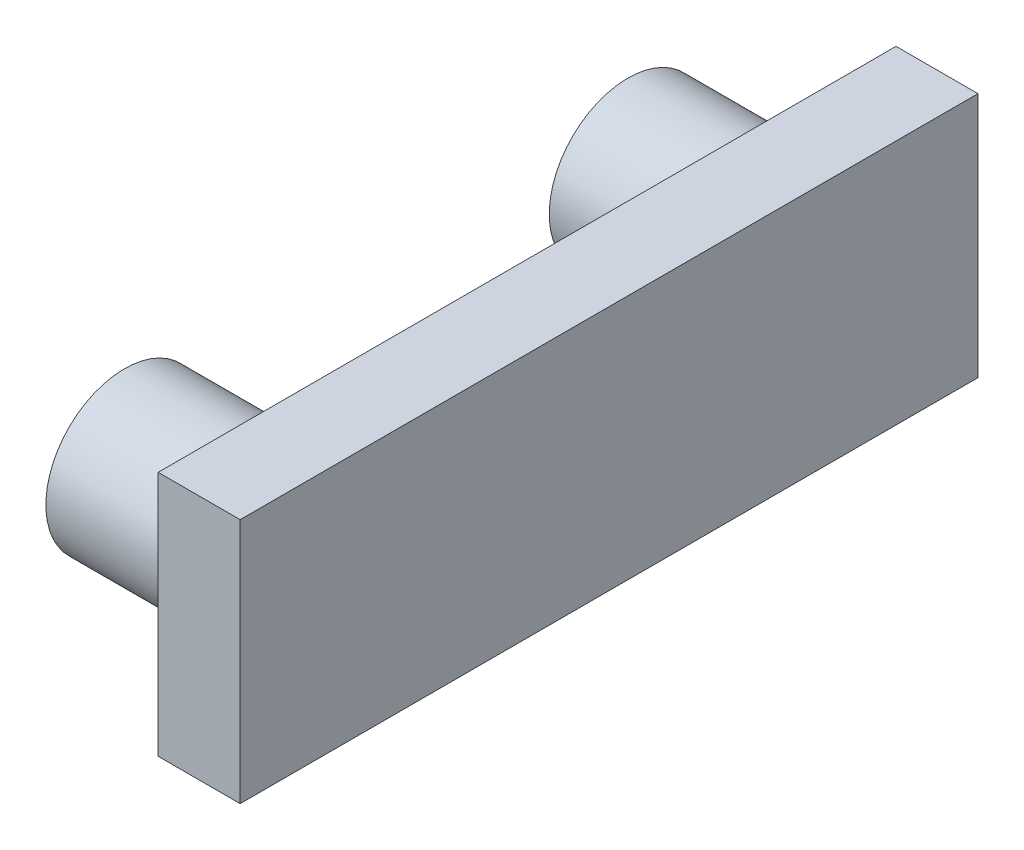
from build123d import *

# Parameters (mm, degrees)
SKETCH1_W           = 15
SKETCH1_H           = 45
BOSS_EXTRUDE1_DEPTH = 5
SKETCH1_3_R         = 4.8
BOSS_EXTRUDE2_DEPTH = 9.2


with BuildPart() as part:
    # Sketch1 → Boss-Extrude1 (new body)
    with BuildSketch(Plane.YZ):
        Rectangle(SKETCH1_W, SKETCH1_H)
    extrude(amount=BOSS_EXTRUDE1_DEPTH)

    # Sketch1<3> → Boss-Extrude2 (add)
    with BuildSketch(Plane.YZ):
        with Locations((0, 15.35)):
            Circle(SKETCH1_3_R)
        with Locations((0, -15.35)):
            Circle(SKETCH1_3_R)
    extrude(amount=-BOSS_EXTRUDE2_DEPTH)


solid = part.part
